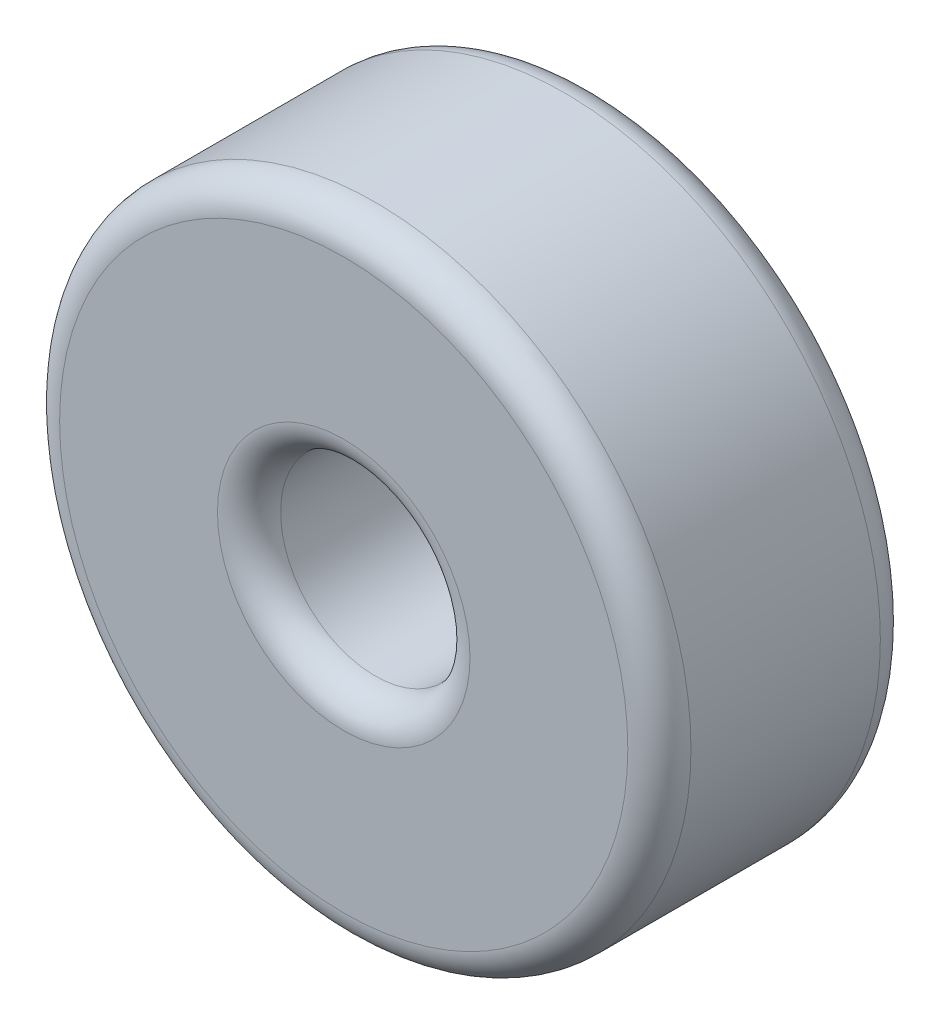
from build123d import *

# Parameters (mm, degrees)
SKETCH_1_R      = 5
SKETCH_1_R_2    = 1.5
EXTRUDE_1_DEPTH = 4
FILLET_1_R      = 0.5


with BuildPart() as part:
    # Эскиз1 → Бобышка-Вытянуть1 (new body)
    with BuildSketch(Plane.XY):
        Circle(SKETCH_1_R)
        Circle(SKETCH_1_R_2, mode=Mode.SUBTRACT)
    extrude(amount=EXTRUDE_1_DEPTH)

    # Скругление1
    fillet_1_edges = [part.edges().sort_by_distance(p)[0] for p in [
        (-1.5, 0, 0),
        (-5, 0, 0),
        (-1.5, 0, 4),
        (-5, 0, 4),
    ]]
    fillet(fillet_1_edges, radius=FILLET_1_R)


solid = part.part
